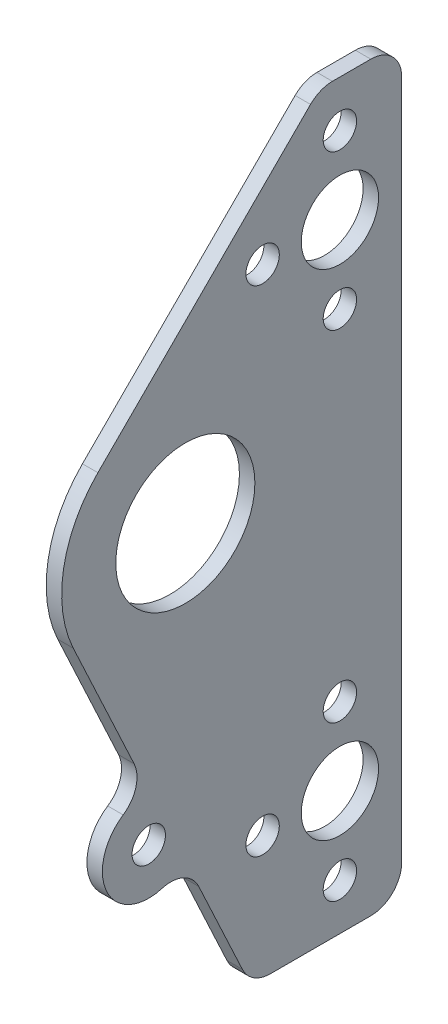
from build123d import *

# Parameters (mm, degrees)
SKETCH1_R           = 14.2875
SKETCH1_R_2         = 7.9375
SKETCH1_R_3         = 3.429
BOSS_EXTRUDE1_DEPTH = 3.175


with BuildPart() as part:
    # Sketch1 → Boss-Extrude1 (new body)
    with BuildSketch(Plane(origin=(0, 0, 0), x_dir=(0, 0, -1), z_dir=(1, 0, 0))):
        with BuildLine():
            Line((25.4, 57.15), (25.4, -82.55))
            ThreePointArc((25.4, -82.55), (23.540128061, -87.040128061), (19.05, -88.9))
            Line((19.05, -88.9), (-1.575652176, -88.9))
            ThreePointArc((-1.575652176, -88.9), (-4.987504689, -87.905535681), (-7.330706623, -85.233625962))
            Line((-7.330706623, -85.233625962), (-16.304501832, -65.989260033))
            ThreePointArc((-16.304501832, -65.989260033), (-19.450268482, -62.883748133), (-23.860481018, -62.583619201))
            ThreePointArc((-23.860481018, -62.583619201), (-35.194449796, -57.475157953), (-31.822423449, -45.509178558))
            ThreePointArc((-31.822423449, -45.509178558), (-29.217505575, -41.937840594), (-29.574405884, -37.53185896))
            Line((-29.574405884, -37.53185896), (-42.070217791, -10.734503848))
            ThreePointArc((-42.070217791, -10.734503848), (-44.064116927, 4.410663713), (-37.010512242, 17.960512242))
            Line((-37.010512242, 17.960512242), (6.669103576, 61.640128061))
            ThreePointArc((6.669103576, 61.640128061), (8.729191841, 63.016635031), (11.159231637, 63.5))
            Line((11.159231637, 63.5), (19.05, 63.5))
            ThreePointArc((19.05, 63.5), (23.540128061, 61.640128061), (25.4, 57.15))
        make_face()
        with Locations((-19.05, 0)):
            Circle(SKETCH1_R, mode=Mode.SUBTRACT)
        with Locations((12.7, 38.1)):
            Circle(SKETCH1_R_2, mode=Mode.SUBTRACT)
        with Locations((12.7, -63.5)):
            Circle(SKETCH1_R_2, mode=Mode.SUBTRACT)
        with Locations((-26.561868124, -53.44971901)):
            Circle(SKETCH1_R_3, mode=Mode.SUBTRACT)
        with Locations((12.7, 53.975)):
            Circle(SKETCH1_R_3, mode=Mode.SUBTRACT)
        with Locations((-3.175, -63.5)):
            Circle(SKETCH1_R_3, mode=Mode.SUBTRACT)
        with Locations((12.7, -47.625)):
            Circle(SKETCH1_R_3, mode=Mode.SUBTRACT)
        with Locations((12.7, -79.375)):
            Circle(SKETCH1_R_3, mode=Mode.SUBTRACT)
        with Locations((-3.175, 38.1)):
            Circle(SKETCH1_R_3, mode=Mode.SUBTRACT)
        with Locations((12.7, 22.225)):
            Circle(SKETCH1_R_3, mode=Mode.SUBTRACT)
    extrude(amount=BOSS_EXTRUDE1_DEPTH)


solid = part.part
